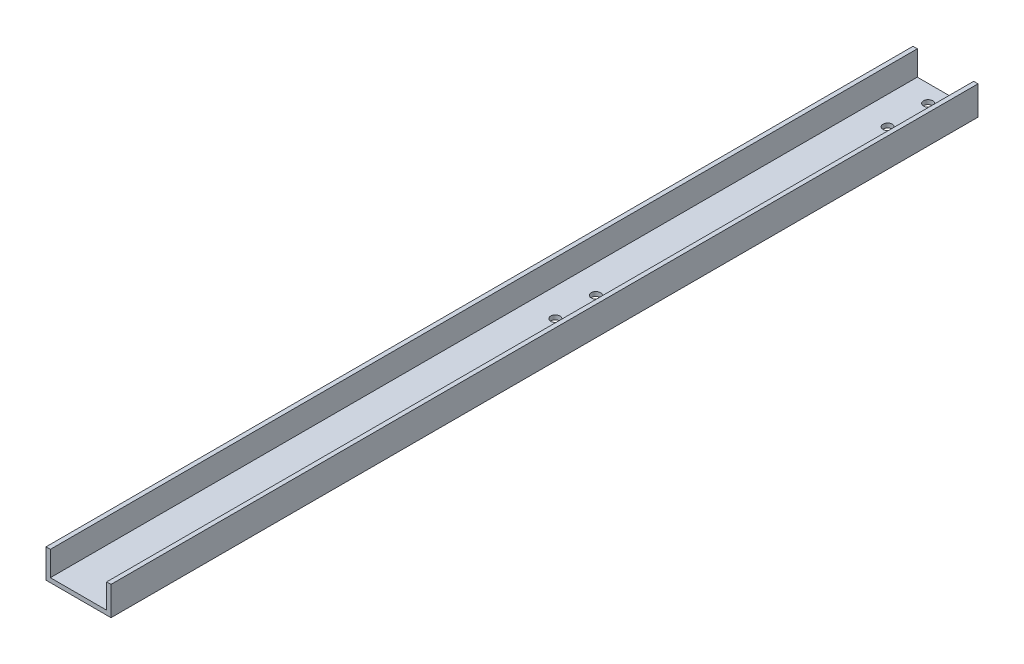
from build123d import *

# Parameters (mm, degrees)
BOSS_EXTRU_1_DEPTH         = 300
ESQUISSE2_R                = 1.6
ENL_V_MAT_EXTRU_1_DEPTH    = 301.377366824
R_P_TITION_LIN_AIRE1_COUNT = 2
R_P_TITION_LIN_AIRE1_PITCH = 115


with BuildPart() as part:
    # Esquisse1 → Boss.-Extru.1 (new body)
    with BuildSketch(Plane.XY):
        Polygon((-11.25, 0), (11.25, 0), (11.25, 10), (9.75, 10), (9.75, 1.5), (-9.75, 1.5), (-9.75, 10), (-11.25, 10), align=None)
    extrude(amount=BOSS_EXTRU_1_DEPTH)

    # Esquisse2 → Enlèv. mat.-Extru.1 (cut, through all)
    with BuildSketch(Plane.XZ):
        with Locations((0, 6)):
            Circle(ESQUISSE2_R)
        with Locations((0, 20)):
            Circle(ESQUISSE2_R)
    enl_v_mat_extru_1 = extrude(amount=-ENL_V_MAT_EXTRU_1_DEPTH, mode=Mode.SUBTRACT)

    # Répétition linéaire1: Enlèv. mat.-Extru.1 ×2
    with Locations(*[(0, 0, i * R_P_TITION_LIN_AIRE1_PITCH) for i in range(1, R_P_TITION_LIN_AIRE1_COUNT)]):
        add(enl_v_mat_extru_1, mode=Mode.SUBTRACT)


solid = part.part
